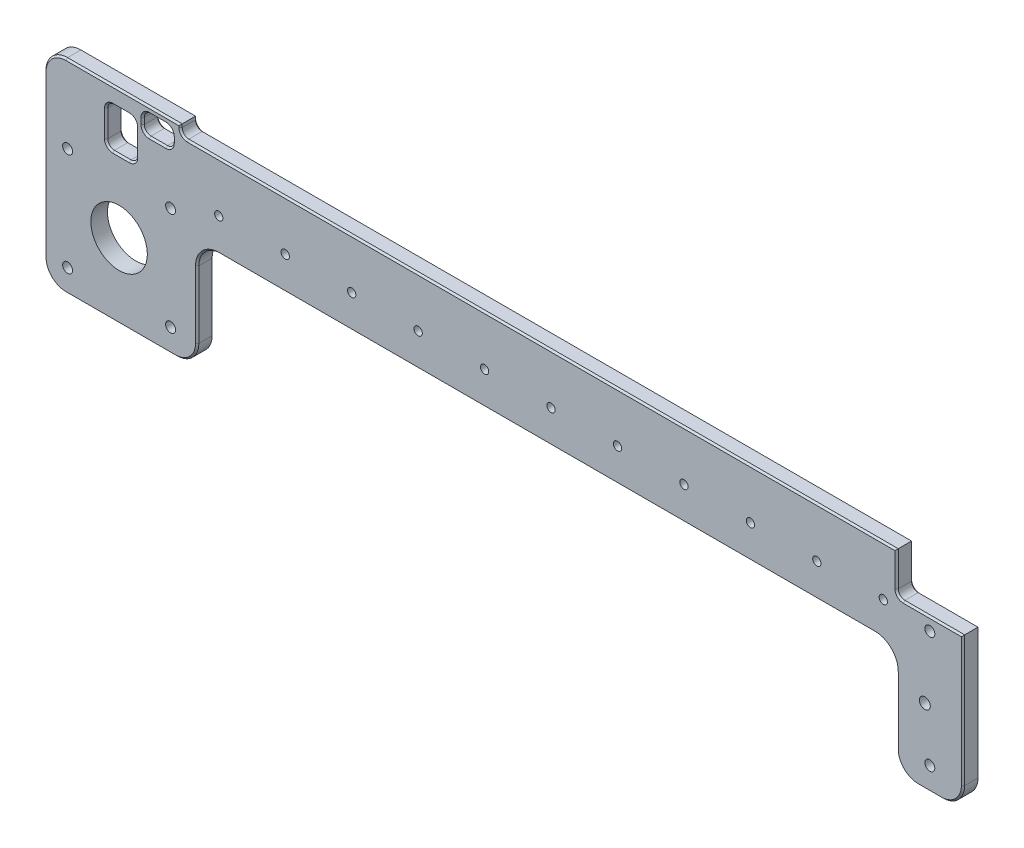
from build123d import *

# Parameters (mm, degrees)
SKETCH1_R           = 1.25
SKETCH1_R_2         = 8.5
SKETCH1_R_3         = 1.5
SKETCH1_R_4         = 1.65
BOSS_EXTRUDE1_DEPTH = 5
CHAMFER1_SIZE       = 0.5


with BuildPart() as part:
    # Sketch1 → Boss-Extrude1 (new body)
    with BuildSketch(Plane.XY):
        with BuildLine():
            Line((0, -10), (197.5, -10))
            ThreePointArc((197.5, -10), (202.096194078, -11.903805922), (204, -16.5))
            Line((204, -16.5), (204, -36.746197724))
            ThreePointArc((204, -36.746197724), (205.903805922, -41.342391801), (210.5, -43.246197724))
            Line((210.5, -43.246197724), (217.5, -43.246197724))
            ThreePointArc((217.5, -43.246197724), (222.096194078, -41.342391801), (224, -36.746197724))
            Line((224, -36.746197724), (224, 2.55))
            Line((224, 2.55), (206, 2.55))
            ThreePointArc((206, 2.55), (204.585786438, 3.135786438), (204, 4.55))
            Line((204, 4.55), (204, 15))
            Line((204, 15), (-9.5, 15))
            ThreePointArc((-9.5, 15), (-10.914213562, 15.585786438), (-11.5, 17))
            Line((-11.5, 17), (-11.5, 18))
            Line((-11.5, 18), (-46, 18))
            ThreePointArc((-46, 18), (-50.596194078, 16.096194078), (-52.5, 11.5))
            Line((-52.5, 11.5), (-52.5, -36.746197724))
            ThreePointArc((-52.5, -36.746197724), (-50.596194078, -41.342391801), (-46, -43.246197724))
            Line((-46, -43.246197724), (-13, -43.246197724))
            ThreePointArc((-13, -43.246197724), (-8.403805922, -41.342391801), (-6.5, -36.746197724))
            Line((-6.5, -36.746197724), (-6.5, -16.5))
            ThreePointArc((-6.5, -16.5), (-4.596194078, -11.903805922), (0, -10))
        make_face()
        Circle(SKETCH1_R, mode=Mode.SUBTRACT)
        with Locations((20, 0)):
            Circle(SKETCH1_R, mode=Mode.SUBTRACT)
        with Locations((40, 0)):
            Circle(SKETCH1_R, mode=Mode.SUBTRACT)
        with Locations((60, 0)):
            Circle(SKETCH1_R, mode=Mode.SUBTRACT)
        with Locations((80, 0)):
            Circle(SKETCH1_R, mode=Mode.SUBTRACT)
        with Locations((100, 0)):
            Circle(SKETCH1_R, mode=Mode.SUBTRACT)
        with Locations((120, 0)):
            Circle(SKETCH1_R, mode=Mode.SUBTRACT)
        with Locations((140, 0)):
            Circle(SKETCH1_R, mode=Mode.SUBTRACT)
        with Locations((160, 0)):
            Circle(SKETCH1_R, mode=Mode.SUBTRACT)
        with Locations((180, 0)):
            Circle(SKETCH1_R, mode=Mode.SUBTRACT)
        with Locations((-30, -20.746197724)):
            Circle(SKETCH1_R_2, mode=Mode.SUBTRACT)
        with Locations((-45.5, -5.246197724)):
            Circle(SKETCH1_R_3, mode=Mode.SUBTRACT)
        with Locations((-14.5, -5.246197724)):
            Circle(SKETCH1_R_3, mode=Mode.SUBTRACT)
        with Locations((-45.5, -36.246197724)):
            Circle(SKETCH1_R_3, mode=Mode.SUBTRACT)
        with Locations((-14.5, -36.246197724)):
            Circle(SKETCH1_R_3, mode=Mode.SUBTRACT)
        with Locations((200, 0)):
            Circle(SKETCH1_R, mode=Mode.SUBTRACT)
        with Locations((212.5, -20.746197724)):
            Circle(SKETCH1_R_4, mode=Mode.SUBTRACT)
        with Locations((214, -36.246197724)):
            Circle(SKETCH1_R_3, mode=Mode.SUBTRACT)
        with Locations((214, -1.246197724)):
            Circle(SKETCH1_R_3, mode=Mode.SUBTRACT)
        with BuildLine():
            Line((-20.9, 16), (-15.9, 16))
            ThreePointArc((-15.9, 16), (-14.485786438, 15.414213562), (-13.9, 14))
            Line((-13.9, 14), (-13.9, 12.12))
            ThreePointArc((-13.9, 12.12), (-14.485786438, 10.705786438), (-15.9, 10.12))
            Line((-15.9, 10.12), (-20.9, 10.12))
            ThreePointArc((-20.9, 10.12), (-22.314213562, 10.705786438), (-22.9, 12.12))
            Line((-22.9, 12.12), (-22.9, 14))
            ThreePointArc((-22.9, 14), (-22.314213562, 15.414213562), (-20.9, 16))
        make_face(mode=Mode.SUBTRACT)
        with BuildLine():
            Line((-26.9, 12.9), (-31.9, 12.9))
            ThreePointArc((-31.9, 12.9), (-33.314213562, 12.314213562), (-33.9, 10.9))
            Line((-33.9, 10.9), (-33.9, 2.9))
            ThreePointArc((-33.9, 2.9), (-33.314213562, 1.485786438), (-31.9, 0.9))
            Line((-31.9, 0.9), (-26.9, 0.9))
            ThreePointArc((-26.9, 0.9), (-25.485786438, 1.485786438), (-24.9, 2.9))
            Line((-24.9, 2.9), (-24.9, 10.9))
            ThreePointArc((-24.9, 10.9), (-25.485786438, 12.314213562), (-26.9, 12.9))
        make_face(mode=Mode.SUBTRACT)
    extrude(amount=BOSS_EXTRUDE1_DEPTH)

    # Chamfer1
    chamfer1_edges = [part.edges().sort_by_distance(p)[0] for p in [
        (98.75, -10, 0),
        (-4.596194078, -11.903805922, 0),
        (-6.5, -26.623098862, 0),
        (-8.403805922, -41.342391801, 0),
        (-29.5, -43.246197724, 0),
        (-52.5, -12.623098862, 0),
        (98.75, -10, 5),
        (-4.596194078, -11.903805922, 5),
        (-6.5, -26.623098862, 5),
        (-8.403805922, -41.342391801, 5),
        (-29.5, -43.246197724, 5),
        (-52.5, -12.623098862, 5),
        (224, -17.098098862, 0),
        (222.096194078, -41.342391801, 0),
        (214, -43.246197724, 0),
        (205.903805922, -41.342391801, 0),
        (204, -26.623098862, 0),
        (202.096194078, -11.903805922, 0),
        (224, -17.098098862, 5),
        (222.096194078, -41.342391801, 5),
        (214, -43.246197724, 5),
        (205.903805922, -41.342391801, 5),
        (204, -26.623098862, 5),
        (202.096194078, -11.903805922, 5),
        (-28.75, 18, 0),
        (-28.75, 18, 5),
        (-50.596194078, 16.096194078, 0),
        (-50.596194078, 16.096194078, 5),
        (-11.5, 17.5, 0),
        (97.25, 15, 0),
        (-11.5, 17.5, 5),
        (97.25, 15, 5),
        (-18.4, 16, 5),
        (-22.314213562, 15.414213562, 5),
        (-14.485786438, 15.414213562, 5),
        (-22.9, 13.06, 5),
        (-13.9, 13.06, 5),
        (-22.314213562, 10.705786438, 5),
        (-14.485786438, 10.705786438, 5),
        (-18.4, 10.12, 5),
        (-18.4, 16, 0),
        (-22.314213562, 15.414213562, 0),
        (-14.485786438, 15.414213562, 0),
        (-22.9, 13.06, 0),
        (-13.9, 13.06, 0),
        (-22.314213562, 10.705786438, 0),
        (-14.485786438, 10.705786438, 0),
        (-18.4, 10.12, 0),
        (-50.596194078, -41.342391801, 0),
        (-50.596194078, -41.342391801, 5),
        (-10.914213562, 15.585786438, 0),
        (-10.914213562, 15.585786438, 5),
        (204, 9.775, 5),
        (204.585786438, 3.135786438, 5),
        (215, 2.55, 5),
        (215, 2.55, 0),
        (204.585786438, 3.135786438, 0),
        (204, 9.775, 0),
        (-29.4, 12.9, 0),
        (-33.314213562, 12.314213562, 0),
        (-25.485786438, 12.314213562, 0),
        (-33.9, 6.9, 0),
        (-24.9, 6.9, 0),
        (-33.314213562, 1.485786438, 0),
        (-25.485786438, 1.485786438, 0),
        (-29.4, 0.9, 0),
        (-29.4, 12.9, 5),
        (-33.314213562, 12.314213562, 5),
        (-25.485786438, 12.314213562, 5),
        (-33.9, 6.9, 5),
        (-24.9, 6.9, 5),
        (-33.314213562, 1.485786438, 5),
        (-25.485786438, 1.485786438, 5),
        (-29.4, 0.9, 5),
    ]]
    chamfer(chamfer1_edges, length=CHAMFER1_SIZE)


solid = part.part
